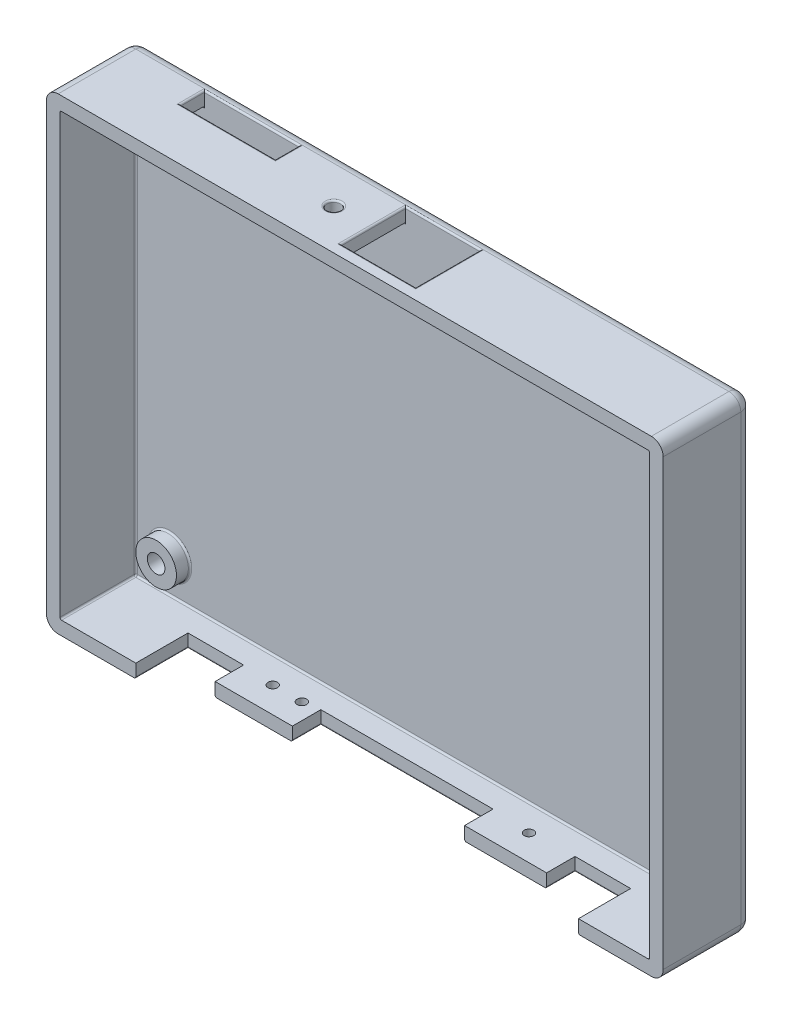
from build123d import *

# Parameters (mm, degrees)
SKETCH1_W           = 91
SKETCH1_H           = 69
BOSS_EXTRUDE1_DEPTH = 13.2
SHELL2_T            = -2
BOSS_EXTRUDE2_DEPTH = 2
SKETCH3_R           = 1.3
CUT_EXTRUDE1_DEPTH  = 4
SKETCH5_R           = 2.1
CUT_EXTRUDE2_DEPTH  = 1.7
SKETCH6_W           = 8.2
SKETCH6_H           = 7.7
SKETCH6_W_2         = 25.4
CUT_EXTRUDE3_DEPTH  = 2
SKETCH7_R           = 0.7
CUT_EXTRUDE4_DEPTH  = 2
SKETCH8_W           = 14
SKETCH8_H           = 3.5
SKETCH8_W_2         = 11
SKETCH8_H_2         = 9.5
CUT_EXTRUDE5_DEPTH  = 2
SKETCH9_R           = 1
CUT_EXTRUDE6_DEPTH  = 2
SKETCH10_W          = 11.4
SKETCH10_H          = 3.5
SKETCH10_W_2        = 12.1
CUT_EXTRUDE8_DEPTH  = 2
FILLET1_R           = 1.75
FILLET2_R           = 0.25
FILLET3_R           = 0.25
FILLET4_R           = 0.25
SKETCH12_W          = 34
SKETCH12_H          = 28
CUT_EXTRUDE9_DEPTH  = 0.2
FILLET5_R           = 0.2


# Some blends are built 0.0001 mm under size
with BuildPart() as part:
    # Sketch1 → Boss-Extrude1 (new body)
    with BuildSketch(Plane.XY):
        with Locations((45.5, 34.5)):
            Rectangle(SKETCH1_W, SKETCH1_H)
    extrude(amount=BOSS_EXTRUDE1_DEPTH)

    # Shell2
    shell2_openings = [part.faces().sort_by_distance(p)[0] for p in [
        (45.5, 34.5, 13.2),
    ]]
    offset(amount=SHELL2_T, openings=shell2_openings, kind=Kind.INTERSECTION)

    # Sketch2 → Boss-Extrude2 (add)
    with BuildSketch(Plane.XY.offset(2)):
        with BuildLine():
            ThreePointArc((4, 7), (4.878679656, 4.878679656), (7, 4))
            Line((7, 4), (7, 7))
            Line((7, 7), (4, 7))
        make_face()
        with BuildLine():
            Line((7, 7), (7, 4))
            ThreePointArc((7, 4), (9.121320344, 4.878679656), (10, 7))
            ThreePointArc((10, 7), (7, 10), (4, 7))
            Line((4, 7), (7, 7))
        make_face()
        with BuildLine():
            ThreePointArc((10, 62), (9.121320344, 64.121320344), (7, 65))
            Line((7, 65), (7, 62))
            Line((7, 62), (4, 62))
            ThreePointArc((4, 62), (7, 59), (10, 62))
        make_face()
        with BuildLine():
            Line((7, 62), (7, 65))
            ThreePointArc((7, 65), (4.878679656, 64.121320344), (4, 62))
            Line((4, 62), (7, 62))
        make_face()
        with BuildLine():
            ThreePointArc((87, 62), (86.121320344, 64.121320344), (84, 65))
            Line((84, 65), (84, 62))
            Line((84, 62), (87, 62))
        make_face()
        with BuildLine():
            Line((84, 62), (84, 65))
            ThreePointArc((84, 65), (81.878679656, 59.878679656), (87, 62))
            Line((87, 62), (84, 62))
        make_face()
        with BuildLine():
            ThreePointArc((87, 7), (81.878679656, 9.121320344), (84, 4))
            Line((84, 4), (84, 7))
            Line((84, 7), (87, 7))
        make_face()
        with BuildLine():
            Line((84, 7), (84, 4))
            ThreePointArc((84, 4), (86.121320344, 4.878679656), (87, 7))
            Line((87, 7), (84, 7))
        make_face()
    extrude(amount=BOSS_EXTRUDE2_DEPTH)

    # Sketch3 → Cut-Extrude1 (cut)
    with BuildSketch(Plane.XY.offset(4)):
        with Locations((7, 62)):
            Circle(SKETCH3_R)
        with Locations((84, 62)):
            Circle(SKETCH3_R)
        with Locations((84, 7)):
            Circle(SKETCH3_R)
        with Locations((7, 7)):
            Circle(SKETCH3_R)
    extrude(amount=-CUT_EXTRUDE1_DEPTH, mode=Mode.SUBTRACT)

    # Sketch5 → Cut-Extrude2 (cut)
    with BuildSketch(Plane(origin=(0, 0, 0), x_dir=(-1, 0, 0), z_dir=(0, 0, -1))):
        with Locations((-84, 62)):
            Circle(SKETCH5_R)
        with Locations((-7, 62)):
            Circle(SKETCH5_R)
        with Locations((-7, 7)):
            Circle(SKETCH5_R)
        with Locations((-84, 7)):
            Circle(SKETCH5_R)
    extrude(amount=-CUT_EXTRUDE2_DEPTH, mode=Mode.SUBTRACT)

    # Sketch6 → Cut-Extrude3 (cut)
    with BuildSketch(Plane(origin=(0, 0, 0), x_dir=(-1, 0, 0), z_dir=(0, -1, 0))):
        with Locations((-17.3, -9.35)):
            Rectangle(SKETCH6_W, SKETCH6_H)
        with Locations((-74.4, -9.35)):
            Rectangle(SKETCH6_W, SKETCH6_H)
        with Locations((-45.5, -9.35)):
            Rectangle(SKETCH6_W_2, SKETCH6_H)
    extrude(amount=-CUT_EXTRUDE3_DEPTH, mode=Mode.SUBTRACT)

    # Sketch7 → Cut-Extrude4 (cut)
    with BuildSketch(Plane(origin=(0, 0, 0), x_dir=(-1, 0, 0), z_dir=(0, -1, 0))):
        with Locations(Location((-26.1, -5.9, 0), (0, 0, 90))):
            Circle(SKETCH7_R)
        with Locations(Location((-30.4, -5.9, 0), (0, 0, 90))):
            Circle(SKETCH7_R)
        with Locations(Location((-63.9, -5.9, 0), (0, 0, 90))):
            Circle(SKETCH7_R)
    extrude(amount=-CUT_EXTRUDE4_DEPTH, mode=Mode.SUBTRACT)

    # Sketch8 → Cut-Extrude5 (cut)
    with BuildSketch(Plane(origin=(0, 69, 0), x_dir=(1, 0, 0), z_dir=(0, 1, 0))):
        with Locations((19.1, -3.75)):
            Rectangle(SKETCH8_W, SKETCH8_H)
        with Locations((47.3, -6.75)):
            Rectangle(SKETCH8_W_2, SKETCH8_H_2)
    extrude(amount=-CUT_EXTRUDE5_DEPTH, mode=Mode.SUBTRACT)

    # Sketch9 → Cut-Extrude6 (cut)
    with BuildSketch(Plane(origin=(0, 69, 0), x_dir=(1, 0, 0), z_dir=(0, 1, 0))):
        with Locations(Location((36.4, -7.2, 0), (0, 0, 270))):
            Circle(SKETCH9_R)
    extrude(amount=-CUT_EXTRUDE6_DEPTH, mode=Mode.SUBTRACT)

    # Sketch10 → Cut-Extrude8 (cut)
    with BuildSketch(Plane(origin=(0, 0, 0), x_dir=(-1, 0, 0), z_dir=(0, -1, 0))):
        with Locations((-27.1, -11.45)):
            Rectangle(SKETCH10_W, SKETCH10_H)
        with Locations((-64.25, -11.45)):
            Rectangle(SKETCH10_W_2, SKETCH10_H)
    extrude(amount=-CUT_EXTRUDE8_DEPTH, mode=Mode.SUBTRACT)

    # Fillet1
    fillet1_edges = [part.edges().sort_by_distance(p)[0] for p in [
        (45.5, 69, 0),
        (91, 34.5, 0),
        (45.5, 0, 0),
        (0, 34.5, 0),
        (0, 69, 6.6),
        (91, 69, 6.6),
        (91, 0, 6.6),
        (0, 0, 6.6),
    ]]
    fillet(fillet1_edges, radius=FILLET1_R)

    # Fillet2
    fillet2_edges = [part.edges().sort_by_distance(p)[0] for p in [
        (13.2, 0, 9.35),
        (17.3, 0, 5.5),
        (21.4, 0, 7.6),
        (74.4, 0, 5.5),
        (78.5, 0, 9.35),
        (45.5, 0, 5.5),
        (58.2, 0, 7.6),
        (26.1, 0, 6.6),
        (30.4, 0, 6.6),
        (63.9, 0, 6.6),
        (12.1, 69, 3.75),
        (19.1, 69, 5.5),
        (26.1, 69, 3.75),
        (19.1, 69, 2),
        (41.8, 69, 6.75),
        (47.3, 69, 11.5),
        (52.8, 69, 6.75),
        (47.3, 69, 2),
        (36.4, 69, 6.2),
        (70.3, 0, 7.6),
        (32.8, 0, 7.6),
        (86.1, 7, 0),
        (9.1, 7, 0),
        (9.1, 62, 0),
        (86.1, 62, 0),
    ]]
    fillet(fillet2_edges, radius=FILLET2_R - 0.0001)  # a hair under: the kernel refuses the full size

    # Fillet3
    fillet3_edges = [part.edges().sort_by_distance(p)[0] for p in [
        (33.95, 67, 2),
        (7.05, 67, 2),
        (2, 34.5, 2),
        (45.5, 2, 2),
        (89, 34.5, 2),
        (70.9, 67, 2),
        (10, 7, 2),
        (7, 59, 2),
        (81, 62, 2),
        (84, 10, 2),
    ]]
    fillet(fillet3_edges, radius=FILLET3_R)

    # Fillet4
    # the kernel refuses this fillet: 0.25 mm, written as the material it adds along each edge
    with BuildSketch(Plane(origin=(2.25, 66.75, 2.25), x_dir=(-1, 0, 0), z_dir=(0, 1, 0))) as fillet4_piece_1_section:
        Polygon((0, 0), (FILLET4_R, 0), (FILLET4_R, -FILLET4_R), (0, -FILLET4_R), align=None)
    fillet4_piece_1 = extrude(amount=FILLET4_R, mode=Mode.PRIVATE)
    fillet4_piece_1 = fillet4_piece_1 - Plane(origin=(2.25, 66.75, 2.25), x_dir=(0.7071067811865475, 0, 0.7071067811865475), z_dir=(0, 1, 0)) * Sphere(FILLET4_R, mode=Mode.PRIVATE)
    add(fillet4_piece_1)
    with BuildSketch(Plane(origin=(88.75, 66.75, 2.25), x_dir=(1, 0, 0), z_dir=(0, 1, 0))) as fillet4_piece_2_section:
        Polygon((0, 0), (FILLET4_R, 0), (FILLET4_R, FILLET4_R), (0, FILLET4_R), align=None)
    fillet4_piece_2 = extrude(amount=FILLET4_R, mode=Mode.PRIVATE)
    fillet4_piece_2 = fillet4_piece_2 - Plane(origin=(88.75, 66.75, 2.25), x_dir=(-0.7071067811865475, 0, 0.7071067811865475), z_dir=(0, 1, 0)) * Sphere(FILLET4_R, mode=Mode.PRIVATE)
    add(fillet4_piece_2)
    with BuildSketch(Plane(origin=(2.25, 2.25, 2.25), x_dir=(-1, 0, 0), z_dir=(0, -1, 0))) as fillet4_piece_3_section:
        Polygon((0, 0), (FILLET4_R, 0), (FILLET4_R, FILLET4_R), (0, FILLET4_R), align=None)
    fillet4_piece_3 = extrude(amount=FILLET4_R, mode=Mode.PRIVATE)
    fillet4_piece_3 = fillet4_piece_3 - Plane(origin=(2.25, 2.25, 2.25), x_dir=(0.7071067811865475, 0, 0.7071067811865475), z_dir=(0, -1, 0)) * Sphere(FILLET4_R, mode=Mode.PRIVATE)
    add(fillet4_piece_3)
    with BuildSketch(Plane(origin=(88.75, 2.25, 2.25), x_dir=(1, 0, 0), z_dir=(0, -1, 0))) as fillet4_piece_4_section:
        Polygon((0, 0), (FILLET4_R, 0), (FILLET4_R, -FILLET4_R), (0, -FILLET4_R), align=None)
    fillet4_piece_4 = extrude(amount=FILLET4_R, mode=Mode.PRIVATE)
    fillet4_piece_4 = fillet4_piece_4 - Plane(origin=(88.75, 2.25, 2.25), x_dir=(-0.7071067811865475, 0, 0.7071067811865475), z_dir=(0, -1, 0)) * Sphere(FILLET4_R, mode=Mode.PRIVATE)
    add(fillet4_piece_4)
    with BuildSketch(Plane(origin=(2, 67, 2.25), x_dir=(1, 0, 0), z_dir=(0, 0, 1)), Plane(origin=(2, 2, 13.2), x_dir=(1, 0, 0), z_dir=(0, 0, -1)), Plane(origin=(89, 2, 2.25), x_dir=(-1, 0, 0), z_dir=(0, 0, 1))) as fillet4_piece_5:
        with BuildLine():
            CenterArc((FILLET4_R, -FILLET4_R), FILLET4_R, 90, 90)
            Line((0, -FILLET4_R), (0, 0))
            Line((0, 0), (FILLET4_R, 0))
        make_face()
    extrude(amount=10.95)
    with BuildSketch(Plane(origin=(89, 67, 2.25), x_dir=(-1, 0, 0), z_dir=(0, 0, 1))) as fillet4_piece_6:
        with BuildLine():
            CenterArc((FILLET4_R, FILLET4_R), FILLET4_R, 180, 90)
            Line((0, FILLET4_R), (0, 0))
            Line((0, 0), (FILLET4_R, 0))
        make_face()
    extrude(amount=10.95)

    # Sketch12 → Cut-Extrude9 (cut)
    with BuildSketch(Plane(origin=(0, 0, 0), x_dir=(-1, 0, 0), z_dir=(0, 0, -1))):
        with Locations((-45.5, 34.5)):
            Rectangle(SKETCH12_W, SKETCH12_H)
    extrude(amount=-CUT_EXTRUDE9_DEPTH, mode=Mode.SUBTRACT)

    # Fillet5
    fillet5_edges = [part.edges().sort_by_distance(p)[0] for p in [
        (45.5, 48.5, 0),
        (62.5, 34.5, 0),
        (28.5, 34.5, 0),
        (45.5, 20.5, 0),
    ]]
    fillet(fillet5_edges, radius=FILLET5_R - 0.0001)  # a hair under: the kernel refuses the full size


solid = part.part
